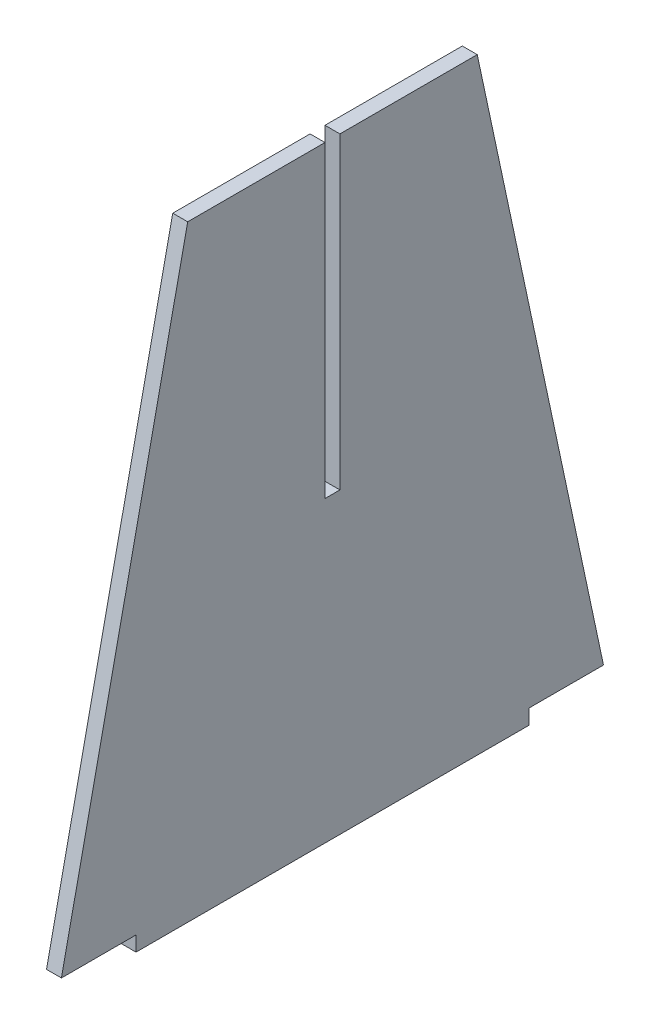
from build123d import *

# Parameters (mm, degrees)
EXTRUDE_1_DEPTH = 3


with BuildPart() as part:
    # Эскиз1 → Бобышка-Вытянуть1 (new body)
    with BuildSketch(Plane(origin=(0, 0, 0), x_dir=(0, 0, -1), z_dir=(1, 0, 0))):
        Polygon((29.113333333, 119), (54.5, 0), (39.5, 0), (39.5, -3), (-39.5, -3), (-39.5, 0), (-54.5, 0), (-29.113333333, 119), (-1.5, 119), (-1.5, 57), (1.5, 57), (1.5, 119), align=None)
    extrude(amount=EXTRUDE_1_DEPTH)


solid = part.part
